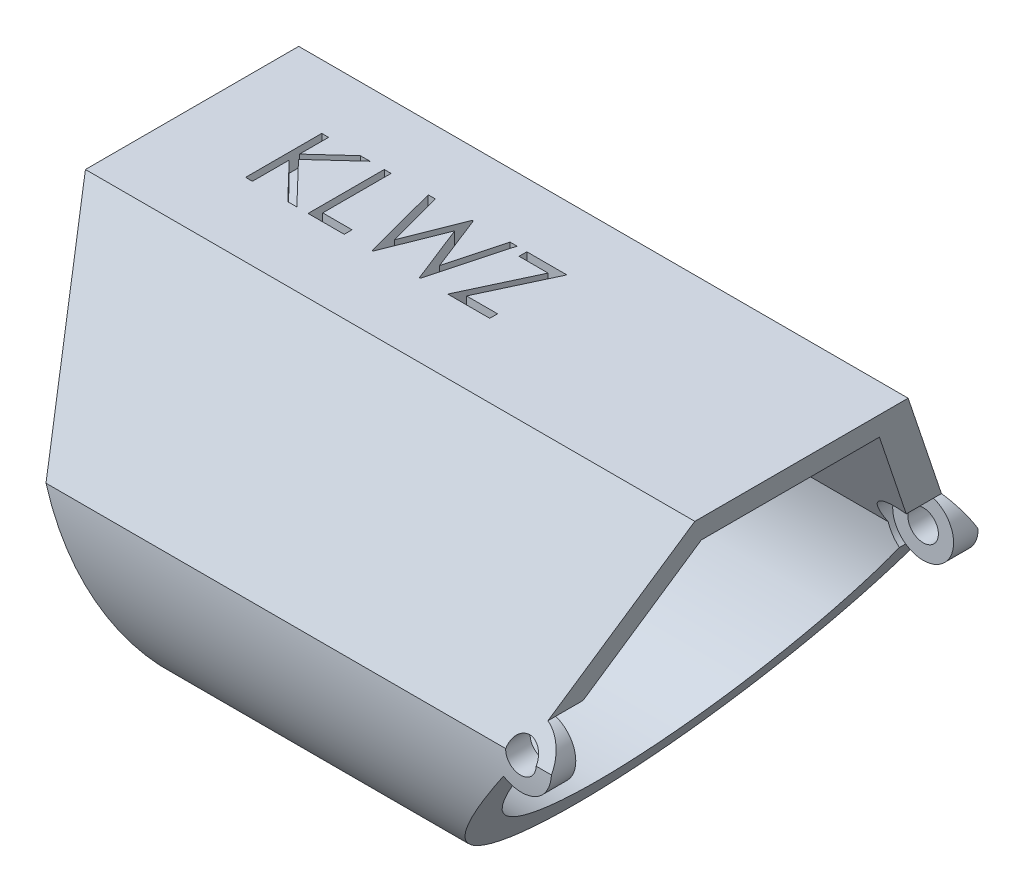
from build123d import *

# Parameters (mm, degrees)
BOSS_EXTRUDE1_DEPTH     = 25.4
SHELL1_T                = -1.27
CUT_EXTRUDE1_DEPTH      = 32.894396236
CUT_EXTRUDE1_DEPTH_BACK = 32.894396236
SKETCH2_R               = 0.635
CUT_EXTRUDE3_DEPTH      = 7.874
CUT_EXTRUDE3_DEPTH_BACK = 7.874
SKETCH4_R               = 1.27
CUT_EXTRUDE2_DEPTH      = 0.762
CUT_EXTRUDE4_START      = -17.111468296
CUT_EXTRUDE4_OUTLINE_W  = 0.990065124
CUT_EXTRUDE4_OUTLINE_H  = 2.54
CUT_EXTRUDE4_DEPTH      = 0.508


# Read off the part's stored shape, not the designer's step: Cut-Extrude4
with BuildPart() as part:
    # Sketch1 → Boss-Extrude1 (new body)
    with BuildSketch(Plane(origin=(0, 0, 0), x_dir=(0, 0, -1), z_dir=(1, 0, 0))):
        with BuildLine():
            Line((-4.445, 0), (4.445, 0))
            Line((4.445, 0), (8.89, -7.69896584))
            ThreePointArc((8.89, -7.69896584), (0, -17.111468296), (-8.89, -7.69896584))
            Line((-8.89, -7.69896584), (-4.445, 0))
        make_face()
    extrude(amount=BOSS_EXTRUDE1_DEPTH)

    # Shell1
    shell1_openings = [part.faces().sort_by_distance(p)[0] for p in [
        (25.4, -8.481857982, 0),
        (0, -8.481857982, 0),
    ]]
    offset(amount=SHELL1_T, openings=shell1_openings, kind=Kind.INTERSECTION)

    # Sketch2 → Cut-Extrude1 (cut, two sides: drawn at the far end of the back side and taken through both)
    with BuildSketch(Plane.XY.offset(-CUT_EXTRUDE1_DEPTH_BACK)):
        with Locations((22.5978056, -7.69896584)):
            Circle(SKETCH2_R)
        with BuildLine():
            Line((25.4, 0), (23.032171182, -6.505556211))
            ThreePointArc((23.032171182, -6.505556211), (23.724309358, -8.285386578), (21.869363526, -8.739288936))
            Line((21.869363526, -8.739288936), (16.007100426, -17.111468296))
            Line((16.007100426, -17.111468296), (25.4, -17.111468296))
            Line((25.4, -17.111468296), (25.4, 0))
        make_face()
        Polygon((0, 0), (6.228065124, -17.111468296), (0, -17.111468296), align=None)
    extrude(amount=CUT_EXTRUDE1_DEPTH + CUT_EXTRUDE1_DEPTH_BACK, mode=Mode.SUBTRACT)

    # Sketch4 → Cut-Extrude3 (cut, two sides: drawn at the far end of the back side and taken through both)
    with BuildSketch(Plane.XY.offset(-CUT_EXTRUDE3_DEPTH_BACK)):
        with Locations((22.5978056, -7.69896584)):
            Circle(SKETCH4_R)
    extrude(amount=CUT_EXTRUDE3_DEPTH + CUT_EXTRUDE3_DEPTH_BACK, mode=Mode.SUBTRACT)

    # Sketch3 → Cut-Extrude2 (cut)
    with BuildSketch(Plane(origin=(0, 0, 0), x_dir=(1, 0, 0), z_dir=(0, 1, 0))):
        Polygon((3.621972553, 1.783922101), (3.906908451, 1.783922101), (3.906908451, 0.57485259), (5.230461135, 1.783922101), (5.6368764, 1.783922101), (4.076725158, 0.359242614), (5.758991784, -1.391077899), (5.37928926, -1.391077899), (3.906908451, 0.141088567), (3.906908451, -1.391077899), (3.621972553, -1.391077899), align=None)
        Polygon((6.227100758, 1.783922101), (6.512036656, 1.783922101), (6.512036656, -1.065436874), (7.733190502, -1.065436874), (7.733190502, -1.391077899), (6.227100758, -1.391077899), align=None)
        Polygon((8.058831528, 1.783922101), (8.35330769, 1.783922101), (8.974696912, -0.544538436), (9.898830526, 1.783922101), (9.940171672, 1.783922101), (10.84713281, -0.528637995), (11.471702121, 1.783922101), (11.762998194, 1.783922101), (10.906918467, -1.391077899), (10.866213339, -1.391077899), (9.910914861, 1.037237405), (8.944168066, -1.391077899), (8.903462938, -1.391077899), align=None)
        Polygon((12.170049476, 1.458281075), (12.170049476, 1.783922101), (13.838959733, 1.783922101), (12.507138819, -1.065436874), (13.798254605, -1.065436874), (13.798254605, -1.391077899), (12.047934092, -1.391077899), (13.379755005, 1.458281075), align=None)
    extrude(amount=-CUT_EXTRUDE2_DEPTH, mode=Mode.SUBTRACT)

    # Cut-Extrude4 outline → Cut-Extrude4 (cut)
    with BuildSketch(Plane(origin=(0, 0, 0), x_dir=(1, 0, 0), z_dir=(0, 1, 0)).offset(CUT_EXTRUDE4_START)):
        with Locations((6.495032562, 0)):
            Rectangle(CUT_EXTRUDE4_OUTLINE_W, CUT_EXTRUDE4_OUTLINE_H)
    extrude(amount=CUT_EXTRUDE4_DEPTH, mode=Mode.SUBTRACT)


solid = part.part
